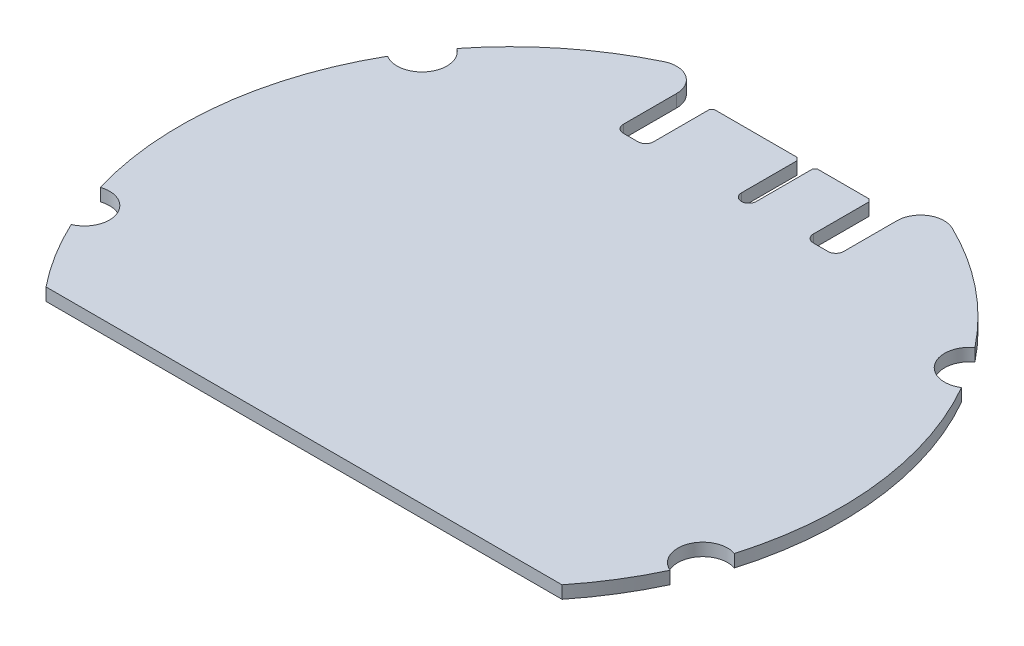
from build123d import *

# Parameters (mm, degrees)
BOSS_EXTRUDE1_DEPTH      = 0.8
BOSS_EXTRUDE1_DEPTH_BACK = 0.8
CUT_EXTRUDE1_REACH       = 59.746
SKETCH3_R                = 3.175
FILLET1_R                = 3
FILLET2_R                = 1


with BuildPart() as part:
    # Sketch1 → Boss-Extrude1 (new, two sides: drawn at the far end of the back side and taken through both)
    with BuildSketch(Plane(origin=(-28.757656934, 0, -23.069119009), x_dir=(1, 0, 0), z_dir=(0, 1, 0)).offset(-BOSS_EXTRUDE1_DEPTH_BACK)):
        with BuildLine():
            ThreePointArc((-13.242343066, -23.069119009), (-10.871376601, -36.980973708), (-4.026166821, -49.322135979))
            Line((-4.026166821, -49.322135979), (61.541480689, -49.322135979))
            ThreePointArc((61.541480689, -49.322135979), (69.146640375, -11.548267626), (42.757656934, 16.528860737))
            Line((42.757656934, 16.528860737), (42.757656934, 4.260880991))
            Line((42.757656934, 4.260880991), (38.907656934, 4.260880991))
            Line((38.907656934, 4.260880991), (38.907656934, 12.3073276))
            Line((38.907656934, 12.3073276), (38.554103543, 12.660880991))
            Line((38.554103543, 12.660880991), (32.061210324, 12.660880991))
            Line((32.061210324, 12.660880991), (31.707656934, 12.3073276))
            Line((31.707656934, 12.3073276), (31.707656934, 5.201715151))
            ThreePointArc((31.707656934, 5.201715151), (30.757656934, 4.260880991), (29.807656934, 5.201715151))
            Line((29.807656934, 5.201715151), (29.807656934, 12.3073276))
            Line((29.807656934, 12.3073276), (29.454103543, 12.660880991))
            Line((29.454103543, 12.660880991), (18.961210324, 12.660880991))
            Line((18.961210324, 12.660880991), (18.607656934, 12.3073276))
            Line((18.607656934, 12.3073276), (18.607656934, 4.260880991))
            Line((18.607656934, 4.260880991), (14.757656934, 4.260880991))
            Line((14.757656934, 4.260880991), (14.757656934, 16.528860737))
            ThreePointArc((14.757656934, 16.528860737), (-5.535199465, 1.179592297), (-13.242343066, -23.069119009))
        make_face()
    extrude(amount=BOSS_EXTRUDE1_DEPTH + BOSS_EXTRUDE1_DEPTH_BACK)

    # Sketch3 → Cut-Extrude1 (cut, up to next)
    with BuildSketch(Plane(origin=(0, 0.8, 0), x_dir=(1, 0, 0), z_dir=(0, 1, 0)), mode=Mode.PRIVATE) as cut_extrude1_sk1:
        with Locations((-34.790101882, 23.529743114)):
            Circle(SKETCH3_R)
    cut_extrude1_tool1 = extrude(cut_extrude1_sk1.sketch, amount=-CUT_EXTRUDE1_REACH, mode=Mode.PRIVATE) & part.part
    # Sketch3 → Cut-Extrude1 (cut, up to next)
    with BuildSketch(Plane(origin=(0, 0.8, 0), x_dir=(1, 0, 0), z_dir=(0, 1, 0)), mode=Mode.PRIVATE) as cut_extrude1_sk2:
        with Locations((39.283837903, -14.858670182)):
            Circle(SKETCH3_R)
    cut_extrude1_tool2 = extrude(cut_extrude1_sk2.sketch, amount=-CUT_EXTRUDE1_REACH, mode=Mode.PRIVATE) & part.part
    # Sketch3 → Cut-Extrude1 (cut, up to next)
    with BuildSketch(Plane(origin=(0, 0.8, 0), x_dir=(1, 0, 0), z_dir=(0, 1, 0)), mode=Mode.PRIVATE) as cut_extrude1_sk3:
        with Locations((-39.283837903, -14.858670182)):
            Circle(SKETCH3_R)
    cut_extrude1_tool3 = extrude(cut_extrude1_sk3.sketch, amount=-CUT_EXTRUDE1_REACH, mode=Mode.PRIVATE) & part.part
    # Sketch3 → Cut-Extrude1 (cut, up to next)
    with BuildSketch(Plane(origin=(0, 0.8, 0), x_dir=(1, 0, 0), z_dir=(0, 1, 0)), mode=Mode.PRIVATE) as cut_extrude1_sk4:
        with Locations((34.790101882, 23.529743114)):
            Circle(SKETCH3_R)
    cut_extrude1_tool4 = extrude(cut_extrude1_sk4.sketch, amount=-CUT_EXTRUDE1_REACH, mode=Mode.PRIVATE) & part.part
    add(cut_extrude1_tool1.solids().sort_by_distance((-34.790102, 0.8, -23.529743))[0], mode=Mode.SUBTRACT)
    add(cut_extrude1_tool2.solids().sort_by_distance((39.283838, 0.8, 14.85867))[0], mode=Mode.SUBTRACT)
    add(cut_extrude1_tool3.solids().sort_by_distance((-39.283838, 0.8, 14.85867))[0], mode=Mode.SUBTRACT)
    add(cut_extrude1_tool4.solids().sort_by_distance((34.790102, 0.8, -23.529743))[0], mode=Mode.SUBTRACT)

    # Fillet1
    fillet1_edges = [part.edges().sort_by_distance(p)[0] for p in [
        (14, 0, -39.597979746),
        (-14, 0, -39.597979746),
    ]]
    fillet(fillet1_edges, radius=FILLET1_R)

    # Fillet2
    fillet2_edges = [part.edges().sort_by_distance(p)[0] for p in [
        (14, 0, -27.33),
        (10.15, 0, -27.33),
        (-10.15, 0, -27.33),
        (-14, 0, -27.33),
    ]]
    fillet(fillet2_edges, radius=FILLET2_R)


solid = part.part
